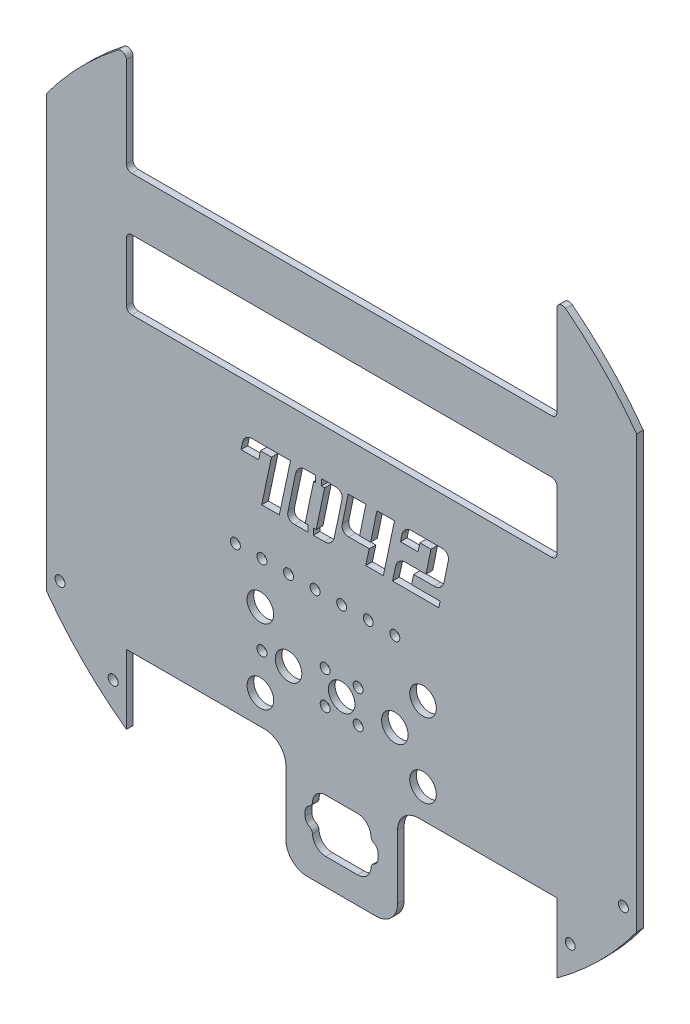
from build123d import *

# Parameters (mm, degrees)
SKETCH1_R               = 2.38125
BOSS_EXTRUDE1_DEPTH     = 3.175
BOSS_EXTRUDE2_DEPTH     = 50.8
CUT_EXTRUDE1_DEPTH      = 209.526843613
CUT_EXTRUDE1_DEPTH_BACK = 209.526843613
SKETCH3_R               = 203.829254644
SKETCH3_R_2             = 174.625
SKETCH5_R               = 2.38125
CUT_EXTRUDE3_DEPTH      = 200.484174202
SKETCH6_W               = 205.731089426
SKETCH6_H               = 25.4
BOSS_EXTRUDE3_DEPTH     = 3.175
SKETCH8_R               = 2.38125
CUT_EXTRUDE5_DEPTH      = 200.484174202
SKETCH9_W               = 205.731089426
SKETCH9_H               = 38.1
BOSS_EXTRUDE4_DEPTH     = 3.175
SKETCH10_R              = 6.35
SKETCH10_R_2            = 2.38125
CUT_EXTRUDE6_DEPTH      = 200.484174202
SKETCH11_W              = 53.331089426
SKETCH11_H              = 50.8
BOSS_EXTRUDE5_DEPTH     = 3.175
FILLET1_R               = 10.16
SKETCH12_R              = 6.35
SKETCH12_R_2            = 2.38125
CUT_EXTRUDE7_DEPTH      = 213.327407372
FILLET2_R               = 2.54
CUT_EXTRUDE8_DEPTH      = 213.327407372
SKETCH14_W              = 2.759281453
SKETCH14_H              = 7.963584416
SKETCH14_W_2            = 2.527010149
SKETCH14_H_2            = 5.938870156
BOSS_EXTRUDE6_DEPTH     = 3.175
FILLET3_R               = 2.54
CUT_EXTRUDE9_DEPTH      = 213.327407514
CUT_EXTRUDE10_DEPTH     = 213.327407514
FILLET4_R               = 2.54
SKETCH17_R              = 6.35
CUT_EXTRUDE11_DEPTH     = 213.327407514


with BuildPart() as part:
    # Sketch1 → Boss-Extrude1 (new body)
    with BuildSketch(Plane.XY):
        with BuildLine():
            Line((-102.865544713, 31.75), (-102.865544713, 145.022480019))
            ThreePointArc((-102.865544713, 145.022480019), (-123.286100955, 128.114703728), (-140.965544713, 108.358457002))
            Line((-140.965544713, 108.358457002), (-140.965544713, -108.358457002))
            ThreePointArc((-140.965544713, -108.358457002), (-123.286100955, -128.114703728), (-102.865544713, -145.022480019))
            Line((-102.865544713, -145.022480019), (-102.865544713, -69.85))
            Line((-102.865544713, -69.85), (102.865544713, -69.85))
            Line((102.865544713, -69.85), (102.865544713, -145.022480019))
            ThreePointArc((102.865544713, -145.022480019), (123.286100955, -128.114703728), (140.965544713, -108.358457002))
            Line((140.965544713, -108.358457002), (140.965544713, 108.358457002))
            ThreePointArc((140.965544713, 108.358457002), (123.286100955, 128.114703728), (102.865544713, 145.022480019))
            Line((102.865544713, 145.022480019), (102.865544713, 31.75))
            Line((102.865544713, 31.75), (-102.865544713, 31.75))
        make_face()
        with Locations((25.4, -38.1)):
            Circle(SKETCH1_R, mode=Mode.SUBTRACT)
        with Locations((0, -38.1)):
            Circle(SKETCH1_R, mode=Mode.SUBTRACT)
        with Locations((-25.4, -38.1)):
            Circle(SKETCH1_R, mode=Mode.SUBTRACT)
    extrude(amount=BOSS_EXTRUDE1_DEPTH)

    # Sketch2 → Boss-Extrude2 (add)
    with BuildSketch(Plane.XY.offset(3.175)):
        with BuildLine():
            ThreePointArc((-102.865544713, -141.111907137), (-123.390730203, -123.566250752), (-140.965544713, -103.06602655))
            Line((-140.965544713, -103.06602655), (-140.965544713, -108.358457002))
            ThreePointArc((-140.965544713, -108.358457002), (-123.286100955, -128.114703728), (-102.865544713, -145.022480019))
            Line((-102.865544713, -145.022480019), (-102.865544713, -141.111907137))
        make_face()
        with BuildLine():
            ThreePointArc((140.965544713, -103.06602655), (123.390730203, -123.566250752), (102.865544713, -141.111907137))
            Line((102.865544713, -141.111907137), (102.865544713, -145.022480019))
            ThreePointArc((102.865544713, -145.022480019), (123.286100955, -128.114703728), (140.965544713, -108.358457002))
            Line((140.965544713, -108.358457002), (140.965544713, -103.06602655))
        make_face()
    extrude(amount=BOSS_EXTRUDE2_DEPTH)

    # Sketch3 → Cut-Extrude1 (cut, two sides: drawn at the far end of the back side and taken through both)
    with BuildSketch(Plane.XY.offset(3.175).offset(-CUT_EXTRUDE1_DEPTH_BACK)):
        Circle(SKETCH3_R)
        Circle(SKETCH3_R_2, mode=Mode.SUBTRACT)
    extrude(amount=CUT_EXTRUDE1_DEPTH + CUT_EXTRUDE1_DEPTH_BACK, mode=Mode.SUBTRACT)

    # Sketch5 → Cut-Extrude3 (cut, through all)
    with BuildSketch(Plane.XY.offset(3.175)):
        with Locations((134.615544713, -95.585904409)):
            Circle(SKETCH5_R)
        with Locations((109.215544713, -123.814275401)):
            Circle(SKETCH5_R)
        with Locations((-134.615544713, -95.585904409)):
            Circle(SKETCH5_R)
        with Locations((-109.215544713, -123.814275401)):
            Circle(SKETCH5_R)
    extrude(amount=-CUT_EXTRUDE3_DEPTH, mode=Mode.SUBTRACT)

    # Sketch6 → Boss-Extrude3 (add)
    with BuildSketch(Plane.XY.offset(3.175)):
        with Locations((0, 77.611907137)):
            Rectangle(SKETCH6_W, SKETCH6_H)
    extrude(amount=-BOSS_EXTRUDE3_DEPTH)

    # Sketch8 → Cut-Extrude5 (cut, through all)
    with BuildSketch(Plane.XY.offset(3.175)):
        with Locations((-38.1, -38.1)):
            Circle(SKETCH8_R)
        with Locations((-50.8, -38.1)):
            Circle(SKETCH8_R)
        with Locations((12.7, -38.1)):
            Circle(SKETCH8_R)
        with Locations((-12.7, -38.1)):
            Circle(SKETCH8_R)
    extrude(amount=-CUT_EXTRUDE5_DEPTH, mode=Mode.SUBTRACT)

    # Sketch9 → Boss-Extrude4 (add)
    with BuildSketch(Plane.XY.offset(3.175)):
        with Locations((0, -88.9)):
            Rectangle(SKETCH9_W, SKETCH9_H)
    extrude(amount=-BOSS_EXTRUDE4_DEPTH)

    # Sketch10 → Cut-Extrude6 (cut, through all)
    with BuildSketch(Plane.XY.offset(3.175)):
        with Locations((0, -76.2)):
            Circle(SKETCH10_R)
        with Locations((-25.4, -76.2)):
            Circle(SKETCH10_R_2)
        with Locations((-38.1, -76.2)):
            Circle(SKETCH10_R_2)
        with Locations((25.4, -76.2)):
            Circle(SKETCH10_R_2)
    extrude(amount=-CUT_EXTRUDE6_DEPTH, mode=Mode.SUBTRACT)

    # Sketch11 → Boss-Extrude5 (add)
    with BuildSketch(Plane.XY.offset(3.175)):
        with Locations((0, -133.35)):
            Rectangle(SKETCH11_W, SKETCH11_H)
    extrude(amount=-BOSS_EXTRUDE5_DEPTH)

    # Fillet1
    fillet1_edges = [part.edges().sort_by_distance(p)[0] for p in [
        (26.665544713, -107.95, 1.5875),
        (-26.665544713, -107.95, 1.5875),
        (-26.665544713, -158.75, 1.5875),
        (26.665544713, -158.75, 1.5875),
    ]]
    fillet(fillet1_edges, radius=FILLET1_R)

    # Sketch12 → Cut-Extrude7 (cut, through all)
    with BuildSketch(Plane.XY.offset(3.175)):
        with Locations((-25.4, -76.2)):
            Circle(SKETCH12_R)
        with Locations((25.4, -76.2)):
            Circle(SKETCH12_R)
        with Locations((-7.874, -68.326)):
            Circle(SKETCH12_R_2)
        with Locations((7.874, -68.326)):
            Circle(SKETCH12_R_2)
        with Locations((7.874, -84.074)):
            Circle(SKETCH12_R_2)
        with Locations((-7.874, -84.074)):
            Circle(SKETCH12_R_2)
    extrude(amount=-CUT_EXTRUDE7_DEPTH, mode=Mode.SUBTRACT)

    # Fillet2
    fillet2_edges = [part.edges().sort_by_distance(p)[0] for p in [
        (102.865544713, 141.111907137, 1.5875),
        (-102.865544713, 141.111907137, 1.5875),
    ]]
    fillet(fillet2_edges, radius=FILLET2_R)

    # Sketch13 → Cut-Extrude8 (cut, through all)
    # profile 1 of 4: a face of its own
    with BuildSketch(Plane.XY.offset(3.175)):
        with BuildLine():
            Line((-29.807958333, -15.810565048), (-38.216416667, -15.810565048))
            Line((-38.216416667, -15.810565048), (-33.538583333, 6.245101619))
            Line((-33.538583333, 6.245101619), (-38.803791667, 6.245101619))
            Line((-38.803791667, 6.245101619), (-39.682208333, 2.075268285))
            Line((-39.682208333, 2.075268285), (-48.095958333, 2.075268285))
            Line((-48.095958333, 2.075268285), (-47.397458333, 5.477809952))
            add(Edge.make_bspline(
                [(-47.397458333, 5.477809952), (-47.320569058, 5.758194134), (-47.170922216, 6.303895823), (-46.789013651, 7.053374007), (-46.29771223, 7.715065901), (-45.690436731, 8.272796577), (-45.006500067, 8.730292102), (-44.253147871, 9.054960677), (-43.448405111, 9.260244914), (-42.891974442, 9.282012228), (-42.6085, 9.293101619)],
                knots=[0, 0, 0, 0, 1.050168006, 2.043904372, 3.024673376, 4.01863537, 5.013909092, 5.989008141, 6.975497172, 8, 8, 8, 8], degree=3))
            Line((-42.6085, 9.293101619), (-24.463375, 9.293101619))
            Line((-24.463375, 9.293101619), (-29.807958333, -15.810565048))
        make_face()
    # profile 2 of 4: a face of its own
    with BuildSketch(Plane.XY.offset(3.175)):
        with BuildLine():
            add(Edge.make_bspline(
                [(-3.566583333, -12.132856715), (-3.643765668, -12.421811436), (-3.79437451, -12.985659844), (-4.17293599, -13.764550451), (-4.665381385, -14.453577746), (-5.270434906, -15.036263062), (-5.950809803, -15.518035961), (-6.703009887, -15.859816489), (-7.511777843, -16.068702787), (-8.070292693, -16.093985699), (-8.355541667, -16.106898381)],
                knots=[0, 0, 0, 0, 1.062369753, 2.073042759, 3.062499936, 4.061251344, 5.048575831, 6.014824268, 6.986115874, 8, 8, 8, 8], degree=3))
            Line((-8.355541667, -16.106898381), (-22.547791667, -16.106898381))
            add(Edge.make_bspline(
                [(-22.547791667, -16.106898381), (-22.69262218, -16.104596964), (-22.972752339, -16.100145578), (-23.378206431, -16.044702396), (-23.755568174, -15.960682303), (-24.107157142, -15.846746121), (-24.426210233, -15.691540895), (-24.716954418, -15.504453058), (-24.976786635, -15.281711317), (-25.203806964, -15.025677099), (-25.40308213, -14.746169713), (-25.554358436, -14.435544628), (-25.674211179, -14.106195373), (-25.74344938, -13.752832717), (-25.791514529, -13.37950469), (-25.77975916, -12.981941289), (-25.73922686, -12.562383844), (-25.682974686, -12.278883611), (-25.654, -12.132856715)],
                knots=[0, 0, 0, 0, 1.158779845, 2.241303809, 3.269110906, 4.251580925, 5.192683609, 6.101443689, 7.012833415, 7.922909267, 8.835720222, 9.751475912, 10.680528402, 11.633319635, 12.628295421, 13.687540584, 14.808885378, 16, 16, 16, 16], degree=3))
            Line((-25.654, -12.132856715), (-21.997458333, 5.319059952))
            add(Edge.make_bspline(
                [(-21.997458333, 5.319059952), (-21.920272116, 5.608009048), (-21.769655695, 6.171846477), (-21.391148554, 6.950815808), (-20.898502375, 7.639552216), (-20.293153244, 8.224337096), (-19.608609326, 8.702683082), (-18.855913228, 9.046275843), (-18.048644228, 9.254382857), (-17.4919553, 9.28003834), (-17.2085, 9.293101619)],
                knots=[0, 0, 0, 0, 1.062516124, 2.073328378, 3.062921881, 4.061810895, 5.05442655, 6.020808115, 6.992233544, 8, 8, 8, 8], degree=3))
            Line((-17.2085, 9.293101619), (-3.01625, 9.293101619))
            add(Edge.make_bspline(
                [(-3.01625, 9.293101619), (-2.871419505, 9.290800192), (-2.591289383, 9.286348788), (-2.185835038, 9.230905733), (-1.808474182, 9.146885197), (-1.456882118, 9.03295056), (-1.137839887, 8.877739913), (-0.847056821, 8.690671483), (-0.587369032, 8.467857656), (-0.359809395, 8.212092615), (-0.16209325, 7.930921186), (-0.002983257, 7.623293687), (0.114459046, 7.2921344), (0.187047795, 6.939473562), (0.223589985, 6.565305639), (0.223678302, 6.168188246), (0.179743785, 5.748571863), (0.123975462, 5.465081675), (0.09525, 5.319059952)],
                knots=[0, 0, 0, 0, 1.158432062, 2.24063113, 3.268129752, 4.250304904, 5.191125136, 6.099612471, 7.010728663, 7.920531375, 8.833068369, 9.75494936, 10.683723015, 11.636228288, 12.62940148, 13.688234619, 14.809242866, 16, 16, 16, 16], degree=3))
            Line((0.09525, 5.319059952), (-3.566583333, -12.132856715))
        make_face()
        Polygon((-13.403791667, 6.245101619), (-17.425458333, -13.058898381), (-12.16025, -13.058898381), (-8.138583333, 6.245101619), align=None, mode=Mode.SUBTRACT)
    # profile 3 of 4: a face of its own
    with BuildSketch(Plane.XY.offset(3.175)):
        with BuildLine():
            Line((11.557, 9.293101619), (8.556625, -5.269565048))
            Line((8.556625, -5.269565048), (13.827125, -5.269565048))
            Line((13.827125, -5.269565048), (16.8275, 9.293101619))
            Line((16.8275, 9.293101619), (25.235958333, 9.293101619))
            Line((25.235958333, 9.293101619), (19.896666667, -16.106898381))
            Line((19.896666667, -16.106898381), (11.482916667, -16.106898381))
            Line((11.482916667, -16.106898381), (13.165666667, -8.317565048))
            Line((13.165666667, -8.317565048), (3.439583333, -8.317565048))
            add(Edge.make_bspline(
                [(3.439583333, -8.317565048), (3.294736233, -8.315312365), (3.014573993, -8.310955241), (2.609344629, -8.25485176), (2.230636814, -8.173029355), (1.881290806, -8.050712181), (1.561052368, -7.897312045), (1.270346477, -7.709804396), (1.009103929, -7.48515858), (0.777806767, -7.227358437), (0.580756638, -6.941550122), (0.426179112, -6.6292081), (0.309007624, -6.297036788), (0.237889907, -5.94070984), (0.190785312, -5.563660832), (0.202000265, -5.162620664), (0.243321079, -4.739613917), (0.29915982, -4.45427987), (0.328083333, -4.306481715)],
                knots=[0, 0, 0, 0, 1.152191709, 2.228561082, 3.250524676, 4.231939746, 5.167691878, 6.071285285, 6.977493388, 7.902223819, 8.821393841, 9.731943086, 10.66895861, 11.616332835, 12.619603957, 13.686867372, 14.801836863, 16, 16, 16, 16], degree=3))
            Line((0.328083333, -4.306481715), (3.14325, 9.293101619))
            Line((3.14325, 9.293101619), (11.557, 9.293101619))
        make_face()
    # profile 4 of 4: a face of its own
    with BuildSketch(Plane.XY.offset(3.175)):
        with BuildLine():
            Line((33.374541667, -13.058898381), (47.0535, -13.058898381))
            Line((47.0535, -13.058898381), (46.392041667, -16.106898381))
            Line((46.392041667, -16.106898381), (24.304625, -16.106898381))
            Line((24.304625, -16.106898381), (25.802166667, -9.143065048))
            add(Edge.make_bspline(
                [(25.802166667, -9.143065048), (25.879273752, -8.861031474), (26.029757165, -8.310610268), (26.410334887, -7.552072135), (26.901419327, -6.879703753), (27.508831265, -6.311820899), (28.191228528, -5.842472815), (28.946271137, -5.513745702), (29.752164487, -5.300517366), (30.311046908, -5.28002739), (30.596416667, -5.269565048)],
                knots=[0, 0, 0, 0, 1.049169808, 2.047576474, 3.031944376, 4.027910562, 5.023553593, 5.994653504, 6.976054309, 8, 8, 8, 8], degree=3))
            Line((30.596416667, -5.269565048), (40.3225, -5.269565048))
            Line((40.3225, -5.269565048), (42.661416667, 6.245101619))
            Line((42.661416667, 6.245101619), (37.396208333, 6.245101619))
            Line((37.396208333, 6.245101619), (36.517791667, 2.075268285))
            Line((36.517791667, 2.075268285), (28.104041667, 2.075268285))
            Line((28.104041667, 2.075268285), (28.802541667, 5.477809952))
            add(Edge.make_bspline(
                [(28.802541667, 5.477809952), (28.879430942, 5.758194134), (29.029077784, 6.303895823), (29.410986349, 7.053374007), (29.90228777, 7.715065901), (30.509563269, 8.272796577), (31.193499933, 8.730292102), (31.946852129, 9.054960677), (32.751594889, 9.260244914), (33.308025558, 9.282012228), (33.5915, 9.293101619)],
                knots=[0, 0, 0, 0, 1.050168006, 2.043904372, 3.024673376, 4.01863537, 5.013909092, 5.989008141, 6.975497172, 8, 8, 8, 8], degree=3))
            Line((33.5915, 9.293101619), (47.78375, 9.293101619))
            add(Edge.make_bspline(
                [(47.78375, 9.293101619), (47.92859726, 9.290849086), (48.208759811, 9.286492252), (48.613987002, 9.230386738), (48.992702458, 9.148571481), (49.342021711, 9.026229282), (49.662353678, 8.87291663), (49.952725098, 8.685096123), (50.214324347, 8.462382804), (50.440285412, 8.20121114), (50.636405741, 7.915869715), (50.798510828, 7.606235104), (50.913345969, 7.272328086), (50.987754572, 6.916671215), (51.023365934, 6.538801464), (51.023963511, 6.138199286), (50.97928388, 5.715135649), (50.923924969, 5.429811378), (50.89525, 5.282018285)],
                knots=[0, 0, 0, 0, 1.152517565, 2.229191352, 3.251443972, 4.233136601, 5.169153376, 6.073002333, 6.979466726, 7.895134038, 8.814564014, 9.731738245, 10.66901877, 11.616660927, 12.618740334, 13.686213184, 14.801498005, 16, 16, 16, 16], degree=3))
            Line((50.89525, 5.282018285), (48.916166667, -4.306481715))
            add(Edge.make_bspline(
                [(48.916166667, -4.306481715), (48.838706266, -4.597052385), (48.687148602, -5.165577869), (48.311448965, -5.952788492), (47.817473721, -6.648200027), (47.212376239, -7.235653604), (46.533647997, -7.724482215), (45.778706123, -8.063324207), (44.971906745, -8.281163221), (44.41262475, -8.30526518), (44.127208333, -8.317565048)],
                knots=[0, 0, 0, 0, 1.06412456, 2.082047477, 3.072647496, 4.071792832, 5.058775816, 6.021176094, 6.990153746, 8, 8, 8, 8], degree=3))
            Line((44.127208333, -8.317565048), (34.395833333, -8.317565048))
            Line((34.395833333, -8.317565048), (33.374541667, -13.058898381))
        make_face()
    extrude(amount=-CUT_EXTRUDE8_DEPTH, mode=Mode.SUBTRACT)


with BuildPart() as cut_extrude8_piece_1:
    # of the separate pieces the step leaves, piece 1, a body of its own (cut_extrude8_pieces)
    add(part.part.solids().sort_by_distance((-106.961346111, 138.033188267, 0))[0])



with BuildPart() as cut_extrude8_piece_2:
    # of the separate pieces the step leaves, piece 2, a body of its own (cut_extrude8_pieces)
    add(part.part.solids().sort_by_distance((-8.138583333, 6.245101619, 0))[0])


with BuildPart() as cut_extrude8_piece_1_1:
    add(cut_extrude8_piece_1.part)

    add(cut_extrude8_piece_2.part)  # Boss-Extrude6 merges Cut-Extrude8 piece 2
    # Sketch14 → Boss-Extrude6 (add)
    with BuildSketch(Plane.XY.offset(3.175)):
        with Locations((-11.017521916, 7.88967512)):
            Rectangle(SKETCH14_W, SKETCH14_H)
        with Locations((-14.795211944, -14.779945163)):
            Rectangle(SKETCH14_W_2, SKETCH14_H_2)
    extrude(amount=-BOSS_EXTRUDE6_DEPTH)

    # Fillet3
    fillet3_edges = [cut_extrude8_piece_1_1.edges().sort_by_distance(p)[0] for p in [
        (-102.865544713, 90.311907137, 1.5875),
        (102.865544713, 90.311907137, 1.5875),
        (102.865544713, 31.75, 1.5875),
        (102.865544713, 64.911907137, 1.5875),
        (-102.865544713, 31.75, 1.5875),
        (-102.865544713, 64.911907137, 1.5875),
    ]]
    fillet(fillet3_edges, radius=FILLET3_R)

    # Sketch15 → Cut-Extrude9 (cut, through all)
    with BuildSketch(Plane.XY.offset(3.175)):
        with BuildLine():
            Line((-7.615544713, -120.65), (7.615544713, -120.65))
            ThreePointArc((7.615544713, -120.65), (12.105672774, -122.509871939), (13.965544713, -127))
            Line((13.965544713, -127), (13.965544713, -139.7))
            ThreePointArc((13.965544713, -139.7), (12.105672774, -144.190128061), (7.615544713, -146.05))
            Line((7.615544713, -146.05), (-7.615544713, -146.05))
            ThreePointArc((-7.615544713, -146.05), (-12.105672774, -144.190128061), (-13.965544713, -139.7))
            Line((-13.965544713, -139.7), (-13.965544713, -127))
            ThreePointArc((-13.965544713, -127), (-12.105672774, -122.509871939), (-7.615544713, -120.65))
        make_face()
    extrude(amount=-CUT_EXTRUDE9_DEPTH, mode=Mode.SUBTRACT)

    # Sketch16 → Cut-Extrude10 (cut, through all)
    with BuildSketch(Plane.XY.offset(3.175)):
        with BuildLine():
            Line((-13.6525, -128.5875), (13.6525, -128.5875))
            ThreePointArc((13.6525, -128.5875), (16.346576836, -129.703423164), (17.4625, -132.3975))
            Line((17.4625, -132.3975), (17.4625, -134.3025))
            ThreePointArc((17.4625, -134.3025), (16.346576836, -136.996576836), (13.6525, -138.1125))
            Line((13.6525, -138.1125), (-13.6525, -138.1125))
            ThreePointArc((-13.6525, -138.1125), (-16.346576836, -136.996576836), (-17.4625, -134.3025))
            Line((-17.4625, -134.3025), (-17.4625, -132.3975))
            ThreePointArc((-17.4625, -132.3975), (-16.346576836, -129.703423164), (-13.6525, -128.5875))
        make_face()
    extrude(amount=-CUT_EXTRUDE10_DEPTH, mode=Mode.SUBTRACT)

    # Fillet4
    fillet4_edges = [cut_extrude8_piece_1_1.edges().sort_by_distance(p)[0] for p in [
        (13.965544713, -138.099617724, 1.5875),
        (13.965544713, -128.600382276, 1.5875),
        (-13.965544713, -138.099617724, 1.5875),
        (-13.965544713, -128.600382276, 1.5875),
    ]]
    fillet(fillet4_edges, radius=FILLET4_R)

    # Sketch17 → Cut-Extrude11 (cut, through all)
    with BuildSketch(Plane.XY.offset(3.175)):
        with Locations((38.862, -93.98)):
            Circle(SKETCH17_R)
        with Locations((-38.862, -93.98)):
            Circle(SKETCH17_R)
        with Locations((38.862, -58.42)):
            Circle(SKETCH17_R)
        with Locations((-38.862, -58.42)):
            Circle(SKETCH17_R)
    extrude(amount=-CUT_EXTRUDE11_DEPTH, mode=Mode.SUBTRACT)


solid = cut_extrude8_piece_1_1.part
